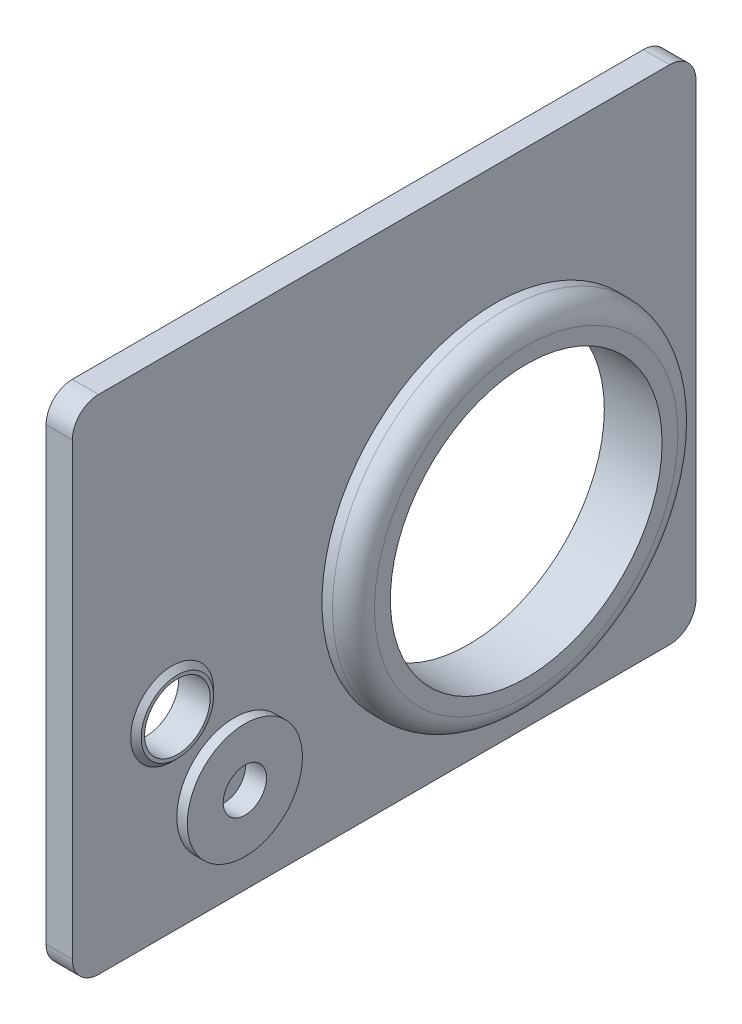
from build123d import *

# Parameters (mm, degrees)
SKETCH1_W           = 118.7383283
SKETCH1_H           = 95.637293174
SKETCH1_R           = 7.894829417
SKETCH1_R_2         = 10.963118073
SKETCH1_R_3         = 32.887608347
BOSS_EXTRUDE1_DEPTH = 5
SKETCH1_3_R         = 32.887608347
SKETCH1_3_R_2       = 25.869040911
BOSS_EXTRUDE2_DEPTH = 11
FILLET1_R           = 4
SKETCH1_4_R         = 10.963118073
SKETCH1_4_R_2       = 4.130606261
BOSS_EXTRUDE3_DEPTH = 7
SKETCH1_5_R         = 7.894829417
SKETCH1_5_R_2       = 6.243605875
BOSS_EXTRUDE4_DEPTH = 6
CHAMFER1_SIZE       = 1
FILLET2_R           = 5
SKETCH1_6_R         = 4.130606261
BOSS_EXTRUDE5_DEPTH = 3


with BuildPart() as part:
    # Sketch1 → Boss-Extrude1 (new body)
    with BuildSketch(Plane(origin=(0, 0, 0), x_dir=(0, 0, -1), z_dir=(1, 0, 0))):
        Rectangle(SKETCH1_W, SKETCH1_H)
        with Locations((-40.363308429, -11.826050305)):
            Circle(SKETCH1_R, mode=Mode.SUBTRACT)
        with Locations((-28.513672981, -29.366301206)):
            Circle(SKETCH1_R_2, mode=Mode.SUBTRACT)
        with Locations((21.052704773, -7.782501182)):
            Circle(SKETCH1_R_3, mode=Mode.SUBTRACT)
    extrude(amount=BOSS_EXTRUDE1_DEPTH)

    # Sketch1<3> → Boss-Extrude2 (add)
    with BuildSketch(Plane(origin=(0, 0, 0), x_dir=(0, 0, -1), z_dir=(1, 0, 0))):
        with Locations((21.052704773, -7.782501182)):
            Circle(SKETCH1_3_R)
        with Locations((21.052704773, -7.782501182)):
            Circle(SKETCH1_3_R_2, mode=Mode.SUBTRACT)
    extrude(amount=BOSS_EXTRUDE2_DEPTH)

    # Fillet1
    fillet1_edges = [part.edges().sort_by_distance(p)[0] for p in [
        (11, -7.782501182, 11.834903573),
    ]]
    fillet(fillet1_edges, radius=FILLET1_R)

    # Sketch1<4> → Boss-Extrude3 (add)
    with BuildSketch(Plane(origin=(0, 0, 0), x_dir=(0, 0, -1), z_dir=(1, 0, 0))):
        with Locations((-28.513672981, -29.366301206)):
            Circle(SKETCH1_4_R)
        with Locations((-28.513672981, -29.366301206)):
            Circle(SKETCH1_4_R_2, mode=Mode.SUBTRACT)
    extrude(amount=BOSS_EXTRUDE3_DEPTH)

    # Sketch1<5> → Boss-Extrude4 (add)
    with BuildSketch(Plane(origin=(0, 0, 0), x_dir=(0, 0, -1), z_dir=(1, 0, 0))):
        with Locations((-40.363308429, -11.826050305)):
            Circle(SKETCH1_5_R)
        with Locations((-40.363308429, -11.826050305)):
            Circle(SKETCH1_5_R_2, mode=Mode.SUBTRACT)
    extrude(amount=BOSS_EXTRUDE4_DEPTH)

    # Chamfer1
    chamfer1_edges = [part.edges().sort_by_distance(p)[0] for p in [
        (6, -11.826050305, 48.258137847),
    ]]
    chamfer(chamfer1_edges, length=CHAMFER1_SIZE - 0.0001)  # a hair under: the kernel refuses the full size

    # Fillet2
    fillet2_edges = [part.edges().sort_by_distance(p)[0] for p in [
        (2.5, -47.818646587, 59.36916415),
        (2.5, 47.818646587, 59.36916415),
        (2.5, 47.818646587, -59.36916415),
        (2.5, -47.818646587, -59.36916415),
    ]]
    fillet(fillet2_edges, radius=FILLET2_R)

    # Sketch1<6> → Boss-Extrude5 (add)
    with BuildSketch(Plane(origin=(0, 0, 0), x_dir=(0, 0, -1), z_dir=(1, 0, 0))):
        with Locations((-28.513672981, -29.366301206)):
            Circle(SKETCH1_6_R)
    extrude(amount=BOSS_EXTRUDE5_DEPTH)


solid = part.part
